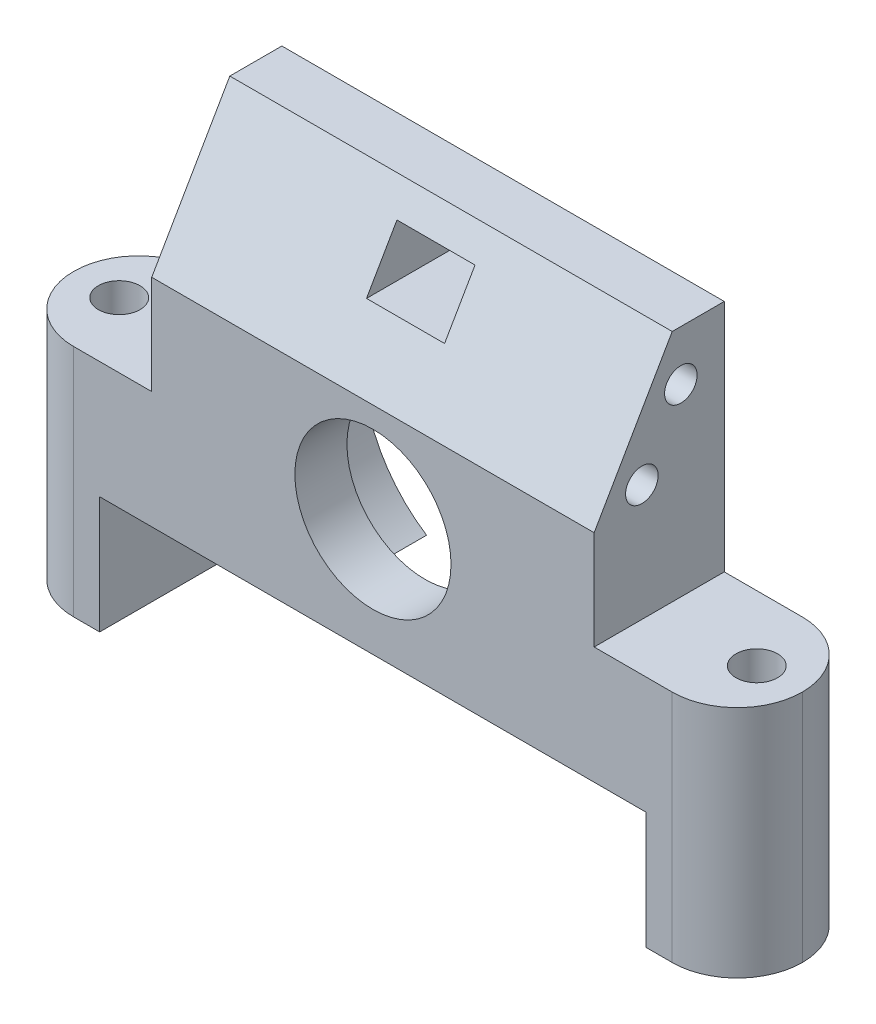
from build123d import *
from OCP.BRepAlgoAPI import BRepAlgoAPI_Cut
from OCP.TopTools import TopTools_ListOfShape
from build123d.topology import SkipClean

# Parameters (mm, degrees)
SKETCH1_R                   = 6
EXTRUDE1_DEPTH              = 10
SKETCH2_R                   = 10.75
CUT_EXTRUDE1_DEPTH          = 6
SKETCH3_R                   = 1.6
CUT_EXTRUDE2_DEPTH          = 8.999999347
SKETCH4_W                   = 7
SKETCH4_H                   = 10
SKETCH4_R                   = 1.6
EXTRUDE3_DEPTH              = 9
FILLET2_R                   = 5
CHAMFER4_SIZE               = 6
CHAMFER4_SIZE2              = 10.392304845
M4_TAPPED_HOLE1_D           = 3.3
M4_TAPPED_HOLE1_DEPTH       = 10.1
M4_TAPPED_HOLE1_TIP         = 0.991420021
SKETCH6_R                   = 1.25
EXTRUDE4_DEPTH              = 4
M3_START                    = 12.4999999
M3_TAPPED_HOLE1_OUTLINE_R   = 1.25
M3_TAPPED_HOLE1_DEPTH       = 0.5000001
M3_START_2                  = -13
M3_TAPPED_HOLE1_2_OUTLINE_R = 1.25
M3_TAPPED_HOLE1_2_DEPTH     = 0.4999999
EXTRUDE5_REACH              = 36.756
SKETCH8_W                   = 6
SKETCH8_H                   = 4.052940251


with BuildPart() as part:
    # Sketch1 → Extrude1 (new body)
    with BuildSketch(Plane.XY):
        Polygon((-17, 6.53e-07), (-28, 6.53e-07), (-28, -8.999999347), (28, -8.999999347), (28, 0), (17, 0), (17, 18.000000653), (-17, 18.000000653), align=None)
        with Locations((0, 6.53e-07)):
            Circle(SKETCH1_R, mode=Mode.SUBTRACT)
    extrude(amount=EXTRUDE1_DEPTH)

    # Sketch2 → Cut-Extrude1 (cut)
    with BuildSketch(Plane(origin=(0, 0, 0), x_dir=(-1, 0, 0), z_dir=(0, 0, -1))):
        Circle(SKETCH2_R)
    extrude(amount=-CUT_EXTRUDE1_DEPTH, mode=Mode.SUBTRACT)


with BuildPart() as cut_extrude2_tool:
    # Sketch3 → Cut-Extrude2 (new body)
    with BuildSketch(Plane(origin=(0, 0, 0), x_dir=(-1, 0, 0), z_dir=(0, 1, 0))):
        with Locations(Location((-24.5, 5, 0), (0, 0, 90))):
            Circle(SKETCH3_R)
        with Locations(Location((24.5, 5, 0), (0, 0, 90))):
            Circle(SKETCH3_R)
    extrude(amount=-CUT_EXTRUDE2_DEPTH)


with BuildPart() as part_1:
    add(part.part)

    # Cut-Extrude2: cut by cut_extrude2_tool, with a tolerance
    cut_extrude2_stock = TopTools_ListOfShape()
    cut_extrude2_stock.Append(part_1.part.wrapped)
    cut_extrude2_tools = TopTools_ListOfShape()
    cut_extrude2_tools.Append(cut_extrude2_tool.part.wrapped)
    cut_extrude2_cut = BRepAlgoAPI_Cut()
    cut_extrude2_cut.SetArguments(cut_extrude2_stock)
    cut_extrude2_cut.SetTools(cut_extrude2_tools)
    cut_extrude2_cut.SetFuzzyValue(0.00001)
    cut_extrude2_cut.Build()
    add(Compound.cast(cut_extrude2_cut.Shape()).solids(), mode=Mode.REPLACE)

    # Sketch4 → Extrude3 (add)
    # profile 1 of 2: a face of its own
    with SkipClean():  # the faces are left unmerged after this step: merging them gives an invalid solid
        with BuildSketch(Plane.XZ.offset(8.999999347)):
            with Locations((-24.5, 5)):
                Rectangle(SKETCH4_W, SKETCH4_H)
            with Locations((-24.5, 5)):
                Circle(SKETCH4_R, mode=Mode.SUBTRACT)
        # profile 2 of 2: a face of its own
        with BuildSketch(Plane.XZ.offset(8.999999347)):
            with Locations((24.5, 5)):
                Rectangle(SKETCH4_W, SKETCH4_H)
            with Locations((24.5, 5)):
                Circle(SKETCH4_R, mode=Mode.SUBTRACT)
        extrude(amount=EXTRUDE3_DEPTH)
    add(part_1.part.scale(1), mode=Mode.REPLACE)  # the faces are merged on a copy

    # Fillet2
    fillet2_edges = [part_1.edges().sort_by_distance(p)[0] for p in [
        (28, -13.499999347, 0),
        (28, -13.499999347, 10),
        (-28, -8.999999347, 0),
        (-28, -8.999999347, 10),
    ]]
    fillet(fillet2_edges, radius=FILLET2_R - 0.0001)  # a hair under: the kernel refuses the full size

    # Chamfer4
    chamfer4_edges = [part_1.edges().sort_by_distance(p)[0] for p in [
        (0, 18.000000653, 10),
    ]]
    chamfer4_side = [part_1.faces().sort_by_distance(p)[0] for p in [
        (0, 18.000000653, 5),
    ]]
    chamfer(chamfer4_edges, length=CHAMFER4_SIZE, length2=CHAMFER4_SIZE2, reference=chamfer4_side[0])

    # M4 Tapped Hole1
    with Locations(Plane(origin=(-24.5, -17.999999347, 5), x_dir=(0, 0, -1), z_dir=(0, -1, 0))):
        with Locations((0, 0), (0, 49)):
            Hole(M4_TAPPED_HOLE1_D / 2, depth=M4_TAPPED_HOLE1_DEPTH)
            with Locations((0, 0, -(M4_TAPPED_HOLE1_DEPTH + M4_TAPPED_HOLE1_TIP / 2))):  # 118° drill point
                Cone(0, M4_TAPPED_HOLE1_D / 2, M4_TAPPED_HOLE1_TIP, mode=Mode.SUBTRACT)

    # Sketch6 → Extrude4 (cut)
    with BuildSketch(Plane.ZY.offset(17)):
        with Locations((3.33604719, 14.150000653)):
            Circle(SKETCH6_R)
        with Locations((6.332495088, 8.960000653)):
            Circle(SKETCH6_R)
    extrude4 = extrude(amount=-EXTRUDE4_DEPTH, mode=Mode.SUBTRACT)

    # Mirror1: Extrude4 across plane
    add(extrude4.mirror(Plane(origin=(0, 0, 0), x_dir=(0, 0, 1), z_dir=(1, 0, 0))), mode=Mode.SUBTRACT)

    # M3 Tapped Hole1: read off the stored shape, not the designer's step
    # M3 Tapped Hole1 outline → M3 Tapped Hole1 (cut)
    with SkipClean():  # the faces are left unmerged after this step: merging them gives an invalid solid
        with BuildSketch(Plane.YZ.offset(M3_START)):
            with Locations((14.150000653, 3.33604719)):
                Circle(M3_TAPPED_HOLE1_OUTLINE_R)
            with Locations((8.960000653, 6.332495088)):
                Circle(M3_TAPPED_HOLE1_OUTLINE_R)
        extrude(amount=M3_TAPPED_HOLE1_DEPTH, mode=Mode.SUBTRACT)

    # M3 Tapped Hole1 2 outline → M3 Tapped Hole1 2 (cut)
    with BuildSketch(Plane.YZ.offset(M3_START_2)):
        with Locations((14.150000653, 3.33604719)):
            Circle(M3_TAPPED_HOLE1_2_OUTLINE_R)
        with Locations((8.960000653, 6.332495088)):
            Circle(M3_TAPPED_HOLE1_2_OUTLINE_R)
    extrude(amount=M3_TAPPED_HOLE1_2_DEPTH, mode=Mode.SUBTRACT)

    # M3 Tapped Hole1 3 outline → M3 Tapped Hole1 3 (revolve, cut)
    with BuildSketch(Plane(origin=(0, 14.150000653, 3.33604719), x_dir=(0, 1, 0), z_dir=(0, 0, -1))):
        Polygon((0, 12.5), (0, 11.748924226), (1.25, 12.5), align=None)
        Polygon((1.25, -12.5), (0, -11.748924226), (0, -12.5000001), align=None)
    revolve(axis=Axis((0, 14.150000653, 3.33604719), (1, 0, 0)), mode=Mode.SUBTRACT)

    # M3 Tapped Hole1 4 outline → M3 Tapped Hole1 4 (revolve, cut)
    with BuildSketch(Plane(origin=(0, 8.960000653, 6.332495088), x_dir=(0, 1, 0), z_dir=(0, 0, -1))):
        Polygon((0, 12.5), (0, 11.748924226), (1.25, 12.5), align=None)
        Polygon((1.25, -12.5), (0, -11.748924226), (0, -12.5000001), align=None)
    revolve(axis=Axis((0, 8.960000653, 6.332495088), (1, 0, 0)), mode=Mode.SUBTRACT)

    # Extrude5: up to this plane
    extrude5_end = Plane(origin=(-17, 7.607695808, 10), z_dir=(0, -0.5000000000000007, -0.8660254037844384))
    # Sketch8 → Extrude5 (cut, up to the surface)
    with BuildSketch(Plane(origin=(0, 0, 0), x_dir=(-1, 0, 0), z_dir=(0, 0, -1)), mode=Mode.PRIVATE) as extrude5_sk1:
        with Locations((0, 13.973529875)):
            Rectangle(SKETCH8_W, SKETCH8_H)
    extrude5_tool1 = split(extrude(extrude5_sk1.sketch, amount=-EXTRUDE5_REACH, mode=Mode.PRIVATE), bisect_by=extrude5_end, keep=Keep.BOTH, mode=Mode.PRIVATE)
    add(extrude5_tool1.solids().sort_by_distance((0, 13.97353, 0))[0], mode=Mode.SUBTRACT)


solid = part_1.part
